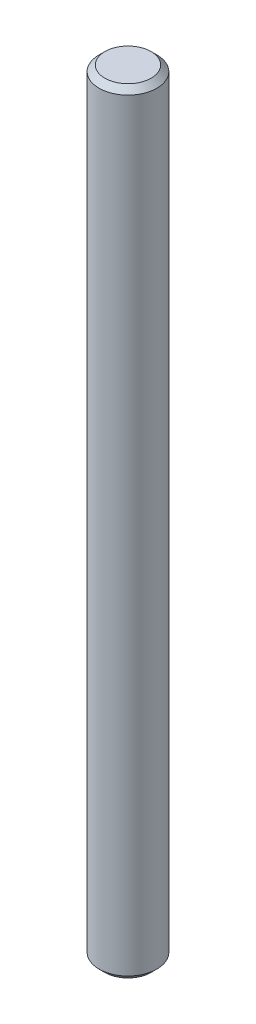
from build123d import *

# Parameters (mm, degrees)
SKETCH1_R           = 2.5
BOSS_EXTRUDE1_DEPTH = 67
CHAMFER1_SIZE       = 0.5


with BuildPart() as part:
    # Sketch1 → Boss-Extrude1 (new body)
    with BuildSketch(Plane(origin=(0, 0, 0), x_dir=(1, 0, 0), z_dir=(0, 1, 0))):
        Circle(SKETCH1_R)
    extrude(amount=BOSS_EXTRUDE1_DEPTH)

    # Chamfer1
    chamfer1_edges = [part.edges().sort_by_distance(p)[0] for p in [
        (-2.5, 67, 0),
        (-2.5, 0, 0),
    ]]
    chamfer(chamfer1_edges, length=CHAMFER1_SIZE)


solid = part.part
